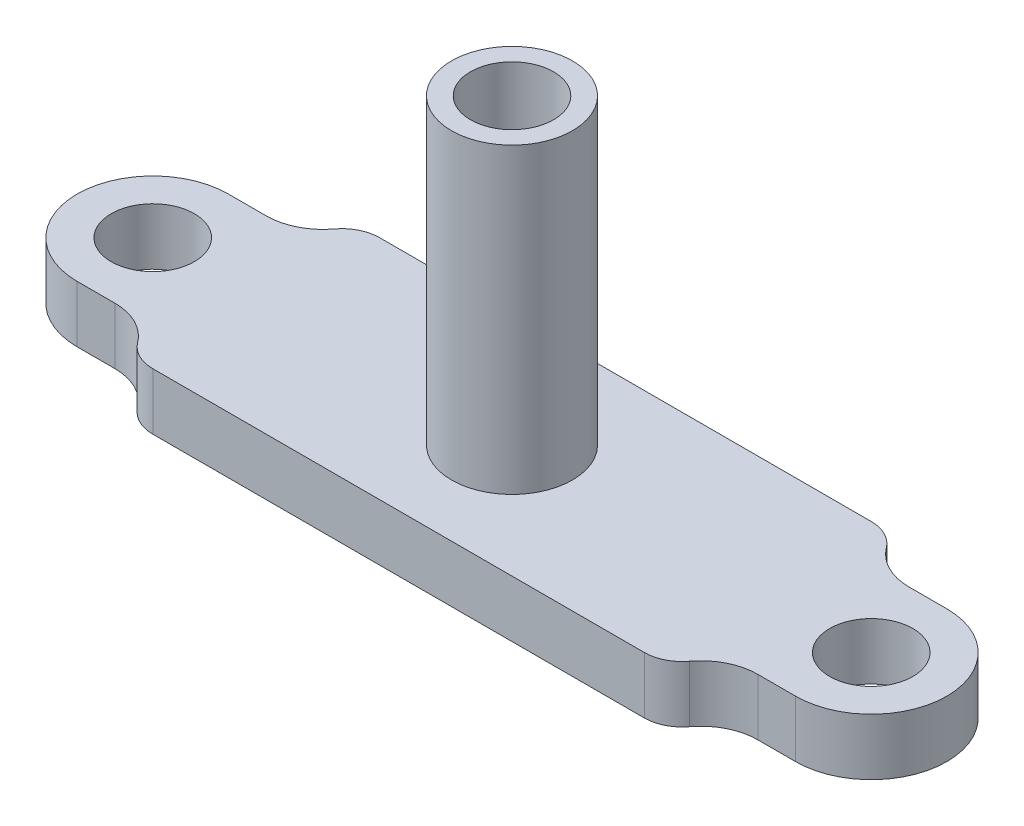
from build123d import *

# Parameters (mm, degrees)
SKETCH1_R           = 1.1
BOSS_EXTRUDE1_DEPTH = 1.5
FILLET1_R           = 1
FILLET2_R           = 1.5
SKETCH2_R           = 1.6
SKETCH2_R_2         = 1.1
BOSS_EXTRUDE2_DEPTH = 8


with BuildPart() as part:
    # Sketch1 → Boss-Extrude1 (new body)
    with BuildSketch(Plane(origin=(0, 0, 0), x_dir=(1, 0, 0), z_dir=(0, 1, 0))):
        with BuildLine():
            Line((-9.5, 2), (-7.5, 2))
            Line((-7.5, 2), (-7.5, 3))
            Line((-7.5, 3), (7.5, 3))
            Line((7.5, 3), (7.5, 2))
            Line((7.5, 2), (9.5, 2))
            ThreePointArc((9.5, 2), (11.5, 0), (9.5, -2))
            Line((9.5, -2), (7.5, -2))
            Line((7.5, -2), (7.5, -3))
            Line((7.5, -3), (-7.5, -3))
            Line((-7.5, -3), (-7.5, -2))
            Line((-7.5, -2), (-9.5, -2))
            ThreePointArc((-9.5, -2), (-11.5, 0), (-9.5, 2))
        make_face()
        with Locations(Location((-9.5, 0, 0), (0, 0, 270))):
            Circle(SKETCH1_R, mode=Mode.SUBTRACT)
        with Locations(Location((9.5, 0, 0), (0, 0, 90))):
            Circle(SKETCH1_R, mode=Mode.SUBTRACT)
    extrude(amount=BOSS_EXTRUDE1_DEPTH)

    # Fillet1
    fillet1_edges = [part.edges().sort_by_distance(p)[0] for p in [
        (7.5, 0.75, 3),
        (7.5, 0.75, -3),
        (-7.5, 0.75, -3),
        (-7.5, 0.75, 3),
    ]]
    fillet(fillet1_edges, radius=FILLET1_R - 0.0001)  # a hair under: the kernel refuses the full size

    # Fillet2
    fillet2_edges = [part.edges().sort_by_distance(p)[0] for p in [
        (7.5, 0.75, -2),
        (7.5, 0.75, 2),
        (-7.5, 0.75, 2),
        (-7.5, 0.75, -2),
    ]]
    fillet(fillet2_edges, radius=FILLET2_R)

    # Sketch2 → Boss-Extrude2 (add)
    with BuildSketch(Plane(origin=(0, 1.5, 0), x_dir=(1, 0, 0), z_dir=(0, 1, 0))):
        with Locations(Location((0, 0, 0), (0, 0, 270))):
            Circle(SKETCH2_R)
        with Locations(Location((0, 0, 0), (0, 0, 270))):
            Circle(SKETCH2_R_2, mode=Mode.SUBTRACT)
    extrude(amount=BOSS_EXTRUDE2_DEPTH)


solid = part.part
